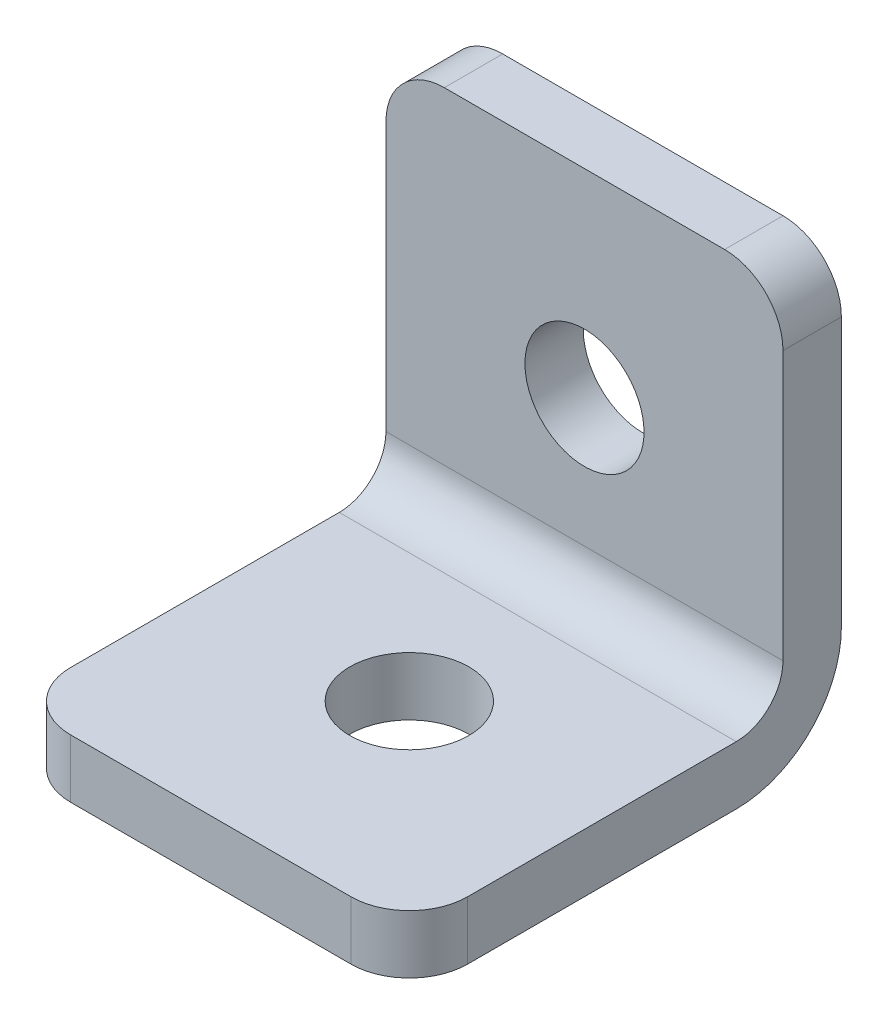
from build123d import *

# Parameters (mm, degrees)
EXTRUDE_1_DEPTH     = 17
FILLET_1_R          = 2.5
SKETCH_2_R          = 2.55
CUT_EXTRUDE_1_DEPTH = 17
SKETCH_3_R          = 2.55
CUT_EXTRUDE_2_DEPTH = 17


with BuildPart() as part:
    # Эскиз1 → Бобышка-Вытянуть1 (new body)
    with BuildSketch(Plane(origin=(0, 0, 0), x_dir=(0, 0, -1), z_dir=(1, 0, 0))):
        with BuildLine():
            Line((14, 2.5), (0, 2.5))
            Line((0, 2.5), (0, 0))
            Line((0, 0), (14, 0))
            ThreePointArc((14, 0), (17.181980515, 1.318019485), (18.5, 4.5))
            Line((18.5, 4.5), (18.5, 18.5))
            Line((18.5, 18.5), (16, 18.5))
            Line((16, 18.5), (16, 4.5))
            ThreePointArc((16, 4.5), (15.414213562, 3.085786438), (14, 2.5))
        make_face()
    extrude(amount=EXTRUDE_1_DEPTH)

    # Скругление1
    fillet_1_edges = [part.edges().sort_by_distance(p)[0] for p in [
        (0, 18.5, -17.25),
        (17, 18.5, -17.25),
        (17, 1.25, 0),
        (0, 1.25, 0),
    ]]
    fillet(fillet_1_edges, radius=FILLET_1_R)

    # Эскиз2 → Вырез-Вытянуть1 (cut)
    with BuildSketch(Plane.XZ):
        with Locations((8.5, -8.5)):
            Circle(SKETCH_2_R)
    extrude(amount=-CUT_EXTRUDE_1_DEPTH, mode=Mode.SUBTRACT)

    # Эскиз3 → Вырез-Вытянуть2 (cut)
    with BuildSketch(Plane(origin=(0, 0, -18.5), x_dir=(-1, 0, 0), z_dir=(0, 0, -1))):
        with Locations((-8.5, 10)):
            Circle(SKETCH_3_R)
    extrude(amount=-CUT_EXTRUDE_2_DEPTH, mode=Mode.SUBTRACT)


solid = part.part
